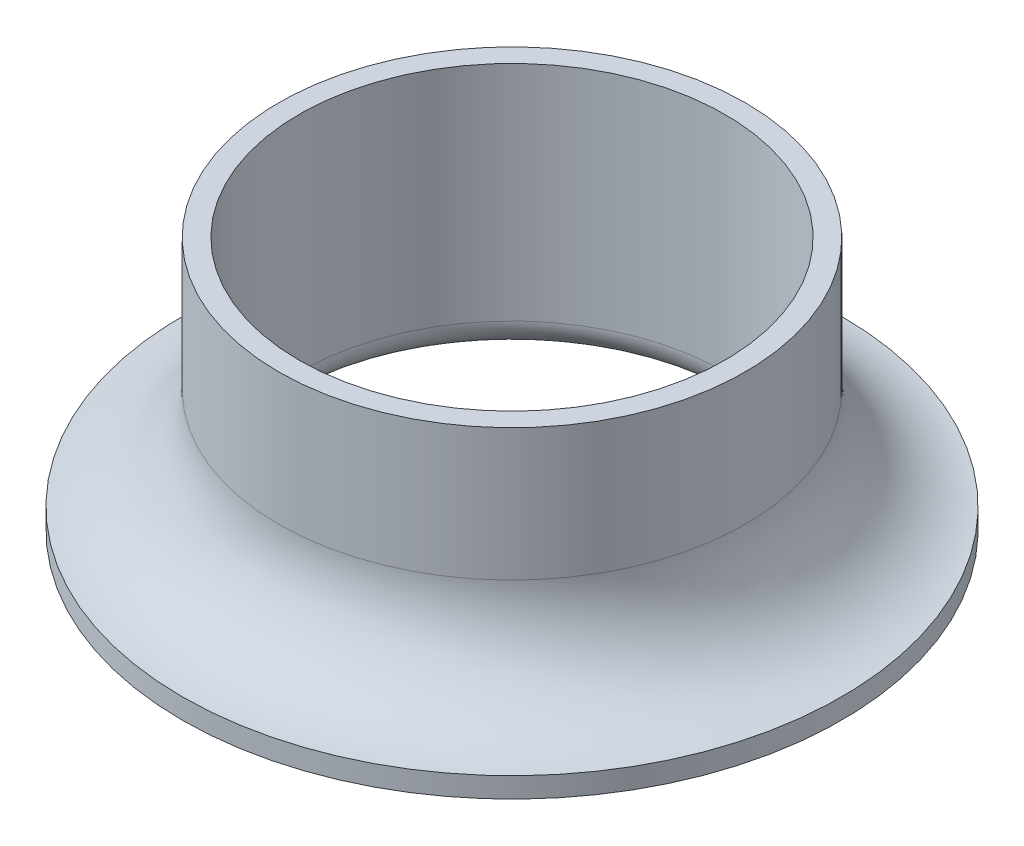
from build123d import *

# Parameters (mm, degrees)
SKETCH1_R           = 23
SKETCH1_R_2         = 21
BOSS_EXTRUDE1_DEPTH = 25
SKETCH2_R           = 32.5
SKETCH2_R_2         = 23
BOSS_EXTRUDE2_DEPTH = 2
FILLET1_R           = 10
FILLET2_R           = 3


with BuildPart() as part:
    # Sketch1 → Boss-Extrude1 (new body)
    with BuildSketch(Plane(origin=(0, 0, 0), x_dir=(1, 0, 0), z_dir=(0, 1, 0))):
        with Locations(Location((0, 0, 0), (0, 0, 270))):
            Circle(SKETCH1_R)
        with Locations(Location((0, 0, 0), (0, 0, 270))):
            Circle(SKETCH1_R_2, mode=Mode.SUBTRACT)
    extrude(amount=BOSS_EXTRUDE1_DEPTH)

    # Sketch2 → Boss-Extrude2 (add)
    with BuildSketch(Plane(origin=(0, 0, 0), x_dir=(1, 0, 0), z_dir=(0, 1, 0))):
        with Locations(Location((0, 0, 0), (0, 0, 270))):
            Circle(SKETCH2_R)
        with Locations(Location((0, 0, 0), (0, 0, 270))):
            Circle(SKETCH2_R_2, mode=Mode.SUBTRACT)
    extrude(amount=BOSS_EXTRUDE2_DEPTH)

    # Fillet1
    # the kernel refuses this fillet: 10 mm, written as the material it adds along each edge
    with BuildSketch(Plane(origin=(0, 2, 0), x_dir=(-1.8e-16, 0, 1), z_dir=(-1, 0, -1.8e-16))) as fillet1_piece_1:
        with BuildLine():
            CenterArc((33, 9.98749217771909), FILLET1_R, 180, 87.13401601740111)
            Line((32.5, 1.78e-15), (32.49, -0.19974984355438008))
            ThreePointArc((32.49, -0.19974984355438008), (27.75, -0.19999999999999996), (23, -0.19999999999999996))
            Line((23, -0.19999999999999996), (22.8, 0))
            Line((22.8, 0), (22.8, 9.98749217771909))
            Line((22.8, 9.98749217771909), (23, 9.98749217771909))
        make_face()
    revolve(axis=Axis((0, 2, 0), (0, 1, 0)))

    # Fillet2
    fillet2_edges = [part.edges().sort_by_distance(p)[0] for p in [
        (6.43e-15, 0, -21),
    ]]
    fillet(fillet2_edges, radius=FILLET2_R)


solid = part.part
